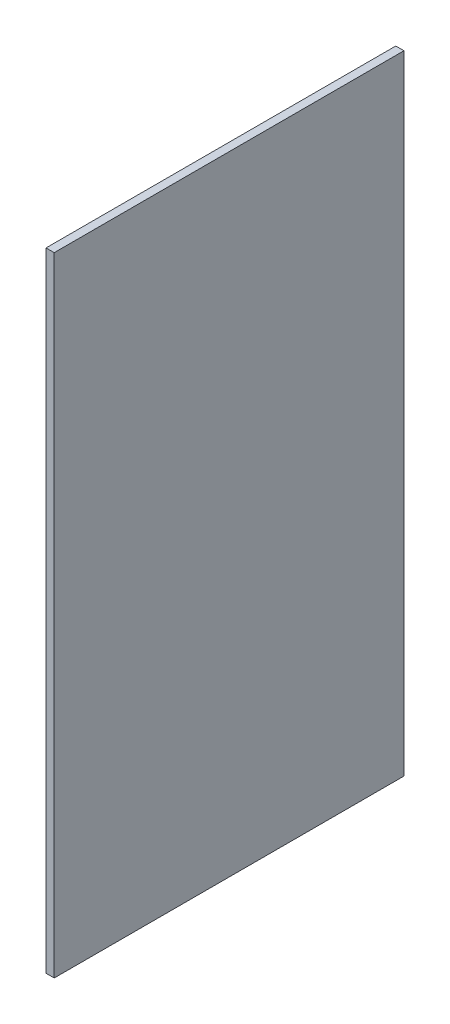
from build123d import *

# Parameters (mm, degrees)
SKETCH1_W           = 19.05
SKETCH1_H           = 1460.04871947
BOSS_EXTRUDE1_DEPTH = 812.8


with BuildPart() as part:
    # Sketch1 → Boss-Extrude1 (new body)
    with BuildSketch(Plane.XY):
        with Locations((-99.00949825, 726.121146921)):
            Rectangle(SKETCH1_W, SKETCH1_H)
    extrude(amount=BOSS_EXTRUDE1_DEPTH)


solid = part.part
